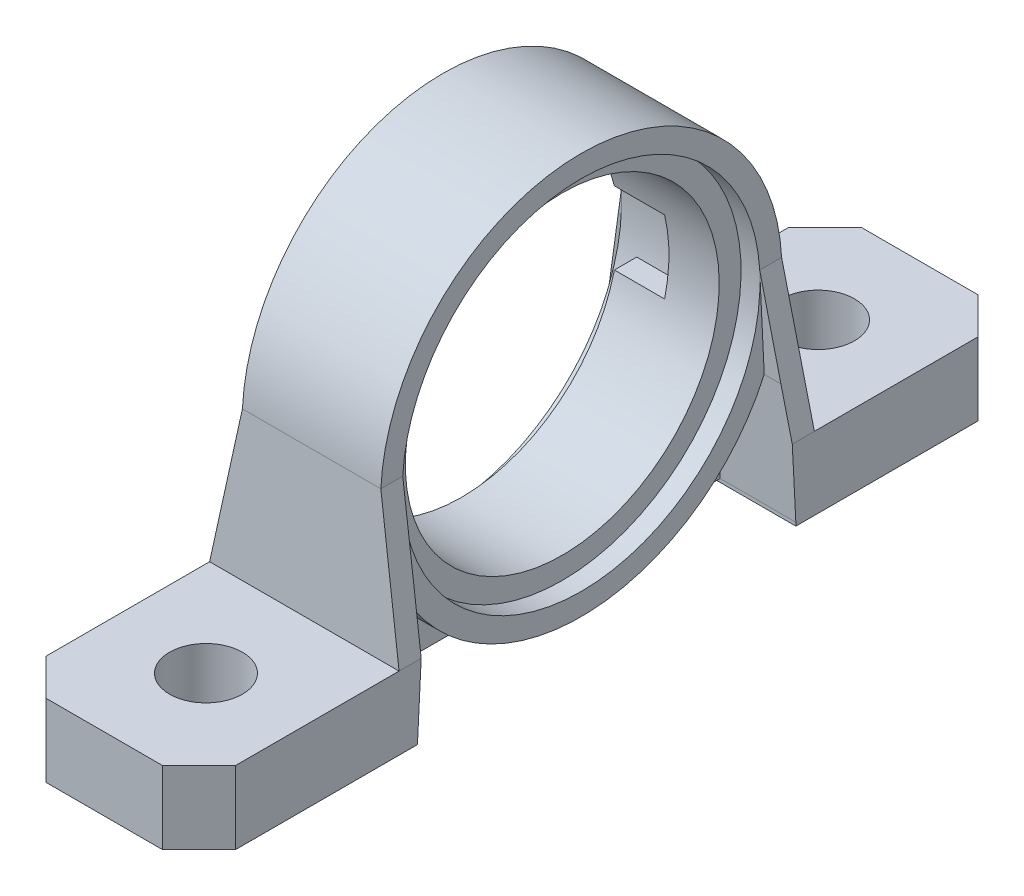
from build123d import *

# Parameters (mm, degrees)
SKETCH1_R              = 13.768224287
SKETCH1_R_2            = 12.268224287
SKETCH1_R_3            = 10.768224287
BOSS_EXTRUDE1_DEPTH    = 6.5
CUT_EXTRUDE3_DEPTH     = 519.353793234
CUT_EXTRUDE1_START     = -1.3
CUT_EXTRUDE1_DEPTH     = 13
CUT_EXTRUDE8_START     = -1.75
CUT_EXTRUDE8_OUTLINE_R = 10.768224287
CUT_EXTRUDE8_DEPTH     = 1.75
SKETCH6_R              = 12.268224287
CUT_EXTRUDE9_DEPTH     = 1.3
CUT_EXTRUDE12_START    = -1.75
CUT_EXTRUDE12_DEPTH    = 1.75
SKETCH8_R              = 2.5
CUT_EXTRUDE13_DEPTH    = 63.803249571
CHAMFER1_SIZE          = 2.5
CUT_EXTRUDE14_START    = -3.45
CUT_EXTRUDE14_DEPTH    = 3.45


# Read off the part's stored shape, not the designer's step: Cut-Extrude8
with BuildPart() as part:
    # Sketch1 → Boss-Extrude1 (new, symmetric)
    # profile 1 of 6: a face of its own
    with BuildSketch(Plane(origin=(0, 0, 0), x_dir=(0, 0, -1), z_dir=(1, 0, 0))):
        with BuildLine():
            Line((0, 5), (0, 0))
            Line((0, 0), (15, 0))
            Line((15, 0), (15, 0.231775713))
            Line((15, 0.231775713), (15.418491318, 8.357342638))
            ThreePointArc((15.418491318, 8.357342638), (14.445072398, 11.461887277), (14.227329557, 14.708166664))
            Line((14.227329557, 14.708166664), (13.727329557, 5))
            Line((13.727329557, 5), (0, 5))
        make_face()
    # profile 2 of 6: a face of its own
    with BuildSketch(Plane(origin=(0, 0, 0), x_dir=(0, 0, -1), z_dir=(1, 0, 0))):
        with BuildLine():
            Line((15.418491318, 8.357342638), (15, 0.231775713))
            Line((15, 0.231775713), (27.977329557, 0.231775713))
            ThreePointArc((27.977329557, 0.231775713), (20.498204345, 2.440299049), (15.418491318, 8.357342638))
        make_face()
    # profile 3 of 6: a face of its own
    with BuildSketch(Plane(origin=(0, 0, 0), x_dir=(0, 0, -1), z_dir=(1, 0, 0))):
        with BuildLine():
            ThreePointArc((40.536167797, 8.357342638), (35.45645477, 2.440299049), (27.977329557, 0.231775713))
            Line((27.977329557, 0.231775713), (40.954659115, 0.231775713))
            Line((40.954659115, 0.231775713), (40.536167797, 8.357342638))
        make_face()
    # profile 4 of 6: a face of its own
    with BuildSketch(Plane(origin=(0, 0, 0), x_dir=(0, 0, -1), z_dir=(1, 0, 0))):
        with BuildLine():
            Line((42.227329557, 5), (41.727329557, 14.708166664))
            ThreePointArc((41.727329557, 14.708166664), (41.740997019, 14.354200561), (41.745553845, 14))
            ThreePointArc((41.745553845, 14), (41.439812643, 11.114597224), (40.536167797, 8.357342638))
            Line((40.536167797, 8.357342638), (40.954659115, 0.231775713))
            Line((40.954659115, 0.231775713), (40.954659115, 0))
            Line((40.954659115, 0), (55.954659115, 0))
            Line((55.954659115, 0), (55.954659115, 5))
            Line((55.954659115, 5), (42.227329557, 5))
        make_face()
    # profile 5 of 6: a face of its own
    with BuildSketch(Plane(origin=(0, 0, 0), x_dir=(0, 0, -1), z_dir=(1, 0, 0))):
        with Locations((27.977329557, 14)):
            Circle(SKETCH1_R)
        with Locations((27.977329557, 14)):
            Circle(SKETCH1_R_2, mode=Mode.SUBTRACT)
    # profile 6 of 6: a face of its own
    with BuildSketch(Plane(origin=(0, 0, 0), x_dir=(0, 0, -1), z_dir=(1, 0, 0))):
        with Locations((27.977329557, 14)):
            Circle(SKETCH1_R_2)
        with Locations(Location((27.977329557, 14, 0), (0, 0, 180))):
            Circle(SKETCH1_R_3, mode=Mode.SUBTRACT)
    extrude(amount=BOSS_EXTRUDE1_DEPTH, both=True)

    # Sketch3 → Cut-Extrude3 (cut, through all)
    with BuildSketch(Plane(origin=(0, -487.515659686, 0), x_dir=(-1, 0, 0), z_dir=(0, 0, 1))):
        Polygon((-4.75, -502.22382635), (-6.5, -492.515659686), (-6.5, -515.283883974), (-4.75, -515.283883974), align=None)
        Polygon((6.5, -515.283883974), (6.5, -492.515659686), (4.75, -502.22382635), (4.75, -515.283883974), align=None)
    extrude(amount=-CUT_EXTRUDE3_DEPTH, mode=Mode.SUBTRACT)

    # Sketch2 → Cut-Extrude1 (cut)
    with BuildSketch(Plane(origin=(0, 0, 0), x_dir=(0, 0, -1), z_dir=(1, 0, 0)).offset(CUT_EXTRUDE1_START)):
        with BuildLine():
            Line((15, 0.231775713), (27.977329557, 0.231775713))
            ThreePointArc((27.977329557, 0.231775713), (20.498204345, 2.440299049), (15.418491318, 8.357342638))
            Line((15.418491318, 8.357342638), (15, 0.231775713))
        make_face()
        with BuildLine():
            Line((27.977329557, 0.231775713), (40.954659115, 0.231775713))
            Line((40.954659115, 0.231775713), (40.536167797, 8.357342638))
            ThreePointArc((40.536167797, 8.357342638), (35.45645477, 2.440299049), (27.977329557, 0.231775713))
        make_face()
    cut_extrude1 = extrude(amount=-CUT_EXTRUDE1_DEPTH, mode=Mode.SUBTRACT)

    # Cut-Extrude8 outline → Cut-Extrude8 (cut)
    with BuildSketch(Plane.ZY.offset(6.5).offset(CUT_EXTRUDE8_START)):
        with BuildLine():
            Line((-40.225097809, 14.708166664), (-40.536167797, 8.357342638))
            ThreePointArc((-40.536167797, 8.357342638), (-27.977329557, 0.231775713), (-15.418491318, 8.357342638))
            Line((-15.418491318, 8.357342638), (-15.729561306, 14.708166664))
            ThreePointArc((-15.729561306, 14.708166664), (-27.977329557, 26.268224287), (-40.225097809, 14.708166664))
        make_face()
        with Locations((-27.977329557, 14)):
            Circle(CUT_EXTRUDE8_OUTLINE_R, mode=Mode.SUBTRACT)
    extrude(amount=CUT_EXTRUDE8_DEPTH, mode=Mode.SUBTRACT)

    # Sketch6 → Cut-Extrude9 (cut)
    with BuildSketch(Plane.ZY.offset(4.75)):
        with Locations(Location((-27.977329557, 14, 0), (0, 0, 270))):
            Circle(SKETCH6_R)
    cut_extrude9 = extrude(amount=-CUT_EXTRUDE9_DEPTH, mode=Mode.SUBTRACT)

    # Mirror2: Cut-Extrude1, Cut-Extrude9 across plane
    add(cut_extrude1.mirror(Plane(origin=(0, 0, 0), x_dir=(0, 0, 1), z_dir=(1, 0, 0))), mode=Mode.SUBTRACT)
    add(cut_extrude9.mirror(Plane(origin=(0, 0, 0), x_dir=(0, 0, 1), z_dir=(1, 0, 0))), mode=Mode.SUBTRACT)

    # Sketch7 → Cut-Extrude12 (cut)
    with BuildSketch(Plane(origin=(6.5, 0, 0), x_dir=(0, 0, -1), z_dir=(1, 0, 0)).offset(CUT_EXTRUDE12_START)):
        with BuildLine():
            ThreePointArc((38.396734532, 5), (39.588438578, 6.600936051), (40.536167797, 8.357342638))
            Line((40.536167797, 8.357342638), (40.225097809, 14.708166664))
            ThreePointArc((40.225097809, 14.708166664), (27.977329557, 26.268224287), (15.729561306, 14.708166664))
            Line((15.729561306, 14.708166664), (15.418491318, 8.357342638))
            ThreePointArc((15.418491318, 8.357342638), (16.366220536, 6.600936051), (17.557924583, 5))
            Line((17.557924583, 5), (22.065083427, 5))
            ThreePointArc((22.065083427, 5), (27.977329557, 3.231775713), (33.889575687, 5))
            Line((33.889575687, 5), (38.396734532, 5))
        make_face()
        with BuildLine():
            Line((22.065083427, 5), (17.557924583, 5))
            ThreePointArc((17.557924583, 5), (27.977329557, 0.231775713), (38.396734532, 5))
            Line((38.396734532, 5), (33.889575687, 5))
            ThreePointArc((33.889575687, 5), (27.977329557, 3.231775713), (22.065083427, 5))
        make_face()
    extrude(amount=CUT_EXTRUDE12_DEPTH, mode=Mode.SUBTRACT)

    # Sketch8 → Cut-Extrude13 (cut, through all)
    with BuildSketch(Plane.XZ):
        with Locations(Location((0, -48.977329557, 0), (0, 0, 270))):
            Circle(SKETCH8_R)
        with Locations(Location((0, -6.977329557, 0), (0, 0, 270))):
            Circle(SKETCH8_R)
    extrude(amount=-CUT_EXTRUDE13_DEPTH, mode=Mode.SUBTRACT)

    # Chamfer1
    chamfer1_edges = [part.edges().sort_by_distance(p)[0] for p in [
        (-6.5, 2.5, 0),
        (6.5, 2.5, -55.954659115),
        (-6.5, 2.5, -55.954659115),
        (6.5, 2.5, 0),
    ]]
    chamfer(chamfer1_edges, length=CHAMFER1_SIZE)

    # Sketch9 → Cut-Extrude14 (cut)
    with BuildSketch(Plane.ZY.offset(3.45).offset(CUT_EXTRUDE14_START)):
        with BuildLine():
            Line((-38.451328521, 16.5), (-39.988129995, 16.5))
            ThreePointArc((-39.988129995, 16.5), (-40.245553845, 14), (-39.988129995, 11.5))
            Line((-39.988129995, 11.5), (-38.451328521, 11.5))
            ThreePointArc((-38.451328521, 11.5), (-38.745553845, 14), (-38.451328521, 16.5))
        make_face()
        with BuildLine():
            ThreePointArc((-15.70910527, 14), (-15.773630921, 15.256609231), (-15.966529119, 16.5))
            Line((-15.966529119, 16.5), (-17.503330593, 16.5))
            ThreePointArc((-17.503330593, 16.5), (-17.282914559, 15.258627083), (-17.20910527, 14))
            ThreePointArc((-17.20910527, 14), (-17.282914559, 12.741372917), (-17.503330593, 11.5))
            Line((-17.503330593, 11.5), (-15.966529119, 11.5))
            ThreePointArc((-15.966529119, 11.5), (-15.773630921, 12.743390769), (-15.70910527, 14))
        make_face()
    extrude(amount=CUT_EXTRUDE14_DEPTH, mode=Mode.SUBTRACT)


solid = part.part
